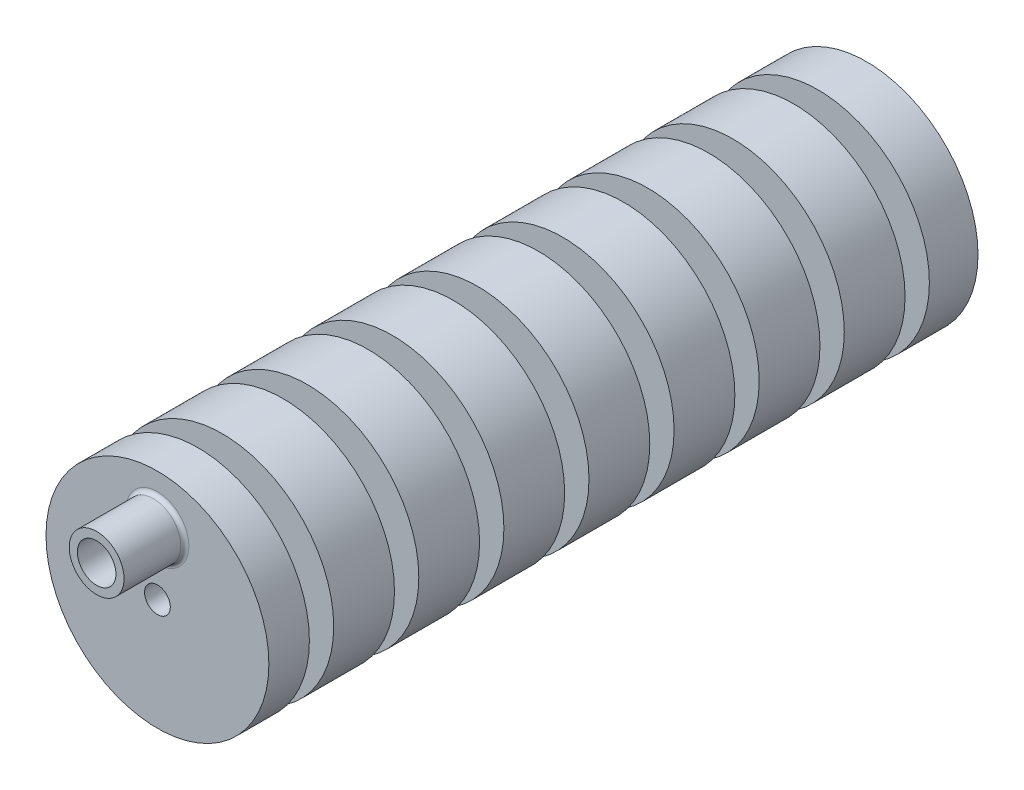
from build123d import *

# Parameters (mm, degrees)
SKETCH3_R             = 27.5
BOSS_EXTRUDE2_DEPTH   = 175
SKETCH5_R             = 3.175
CUT_EXTRUDE1_DEPTH    = 180.26935042
SKETCH4_W             = 16
SKETCH4_H             = 6
SHELL1_START          = 3
SHELL1_OUTLINE_R      = 8.5
SHELL1_OUTLINE_R_2    = 6.175
SHELL1_DEPTH          = 169
SHELL1_START_2        = 21
SHELL1_2_OUTLINE_R    = 24.5
SHELL1_2_OUTLINE_R_2  = 8.5
SHELL1_2_DEPTH        = 9
SHELL1_START_3        = 42
SHELL1_3_OUTLINE_R    = 24.5
SHELL1_3_OUTLINE_R_2  = 8.5
SHELL1_3_DEPTH        = 9
SHELL1_START_4        = 63
SHELL1_4_OUTLINE_R    = 24.5
SHELL1_4_OUTLINE_R_2  = 8.5
SHELL1_4_DEPTH        = 9
SHELL1_START_5        = 84
SHELL1_5_OUTLINE_R    = 24.5
SHELL1_5_OUTLINE_R_2  = 8.5
SHELL1_5_DEPTH        = 9
SHELL1_START_6        = 105
SHELL1_6_OUTLINE_R    = 24.5
SHELL1_6_OUTLINE_R_2  = 8.5
SHELL1_6_DEPTH        = 9
SHELL1_START_7        = 126
SHELL1_7_OUTLINE_R    = 24.5
SHELL1_7_OUTLINE_R_2  = 8.5
SHELL1_7_DEPTH        = 9
SHELL1_START_8        = 147
SHELL1_8_OUTLINE_R    = 24.5
SHELL1_8_OUTLINE_R_2  = 8.5
SHELL1_8_DEPTH        = 9
SHELL1_9_OUTLINE_R    = 24.5
SHELL1_9_OUTLINE_R_2  = 8.5
SHELL1_9_DEPTH        = 6
SHELL1_START_9        = 168
SHELL1_10_OUTLINE_R   = 24.5
SHELL1_10_OUTLINE_R_2 = 8.5
SHELL1_10_DEPTH       = 4
BOSS_EXTRUDE3_REACH   = 181.269
SKETCH11_W            = 6
SKETCH11_H            = 18.622661507
SKETCH11_H_2          = 18.562635142
SKETCH11_H_3          = 18.723636058
SKETCH11_H_4          = 19.102872432
SKETCH11_H_5          = 19.443952445
SKETCH11_H_6          = 20.46765219
SKETCH11_H_7          = 19.166783548
SKETCH11_H_8          = 20.128295153
SKETCH12_W            = 1.25
SKETCH12_H            = 4
SKETCH12_H_2          = 6
SKETCH12_H_3          = 9
SKETCH13_R            = 6.7625
SKETCH13_R_2          = 4.7625
BOSS_EXTRUDE4_DEPTH   = 15
CUT_EXTRUDE2_START    = -20
SKETCH14_R            = 4.7625
CUT_EXTRUDE2_DEPTH    = 20
FILLET1_R             = 1


# Read off the part's stored shape, not the designer's step: Shell1
with BuildPart() as part:
    # Sketch3 → Boss-Extrude2 (new body)
    with BuildSketch(Plane.XY):
        Circle(SKETCH3_R)
    extrude(amount=BOSS_EXTRUDE2_DEPTH)

    # Sketch5 → Cut-Extrude1 (cut, through all)
    with BuildSketch(Plane.XY.offset(175)):
        Circle(SKETCH5_R)
    extrude(amount=-CUT_EXTRUDE1_DEPTH, mode=Mode.SUBTRACT)

    # Sketch4 → Cut-Revolve1 (revolve, cut)
    with BuildSketch(Plane(origin=(0, 0, 0), x_dir=(1, 0, 0), z_dir=(0, 1, 0)), mode=Mode.PRIVATE) as cut_revolve1_sk:
        with Locations((-19.5, -162)):
            Rectangle(SKETCH4_W, SKETCH4_H)
        with Locations((-19.5, -141)):
            Rectangle(SKETCH4_W, SKETCH4_H)
        with Locations((-19.5, -120)):
            Rectangle(SKETCH4_W, SKETCH4_H)
        with Locations((-19.5, -99)):
            Rectangle(SKETCH4_W, SKETCH4_H)
        with Locations((-19.5, -78)):
            Rectangle(SKETCH4_W, SKETCH4_H)
        with Locations((-19.5, -57)):
            Rectangle(SKETCH4_W, SKETCH4_H)
        with Locations((-19.5, -36)):
            Rectangle(SKETCH4_W, SKETCH4_H)
        with Locations((-19.5, -15)):
            Rectangle(SKETCH4_W, SKETCH4_H)
    revolve(cut_revolve1_sk.sketch.rotate(Axis((0, 0, 175), (0, 0, -1)), 180), axis=Axis((0, 0, 175), (0, 0, -1)), mode=Mode.SUBTRACT)

    # Shell1 outline → Shell1 (cut)
    with BuildSketch(Plane.XY.offset(SHELL1_START)):
        Circle(SHELL1_OUTLINE_R)
        Circle(SHELL1_OUTLINE_R_2, mode=Mode.SUBTRACT)
    extrude(amount=SHELL1_DEPTH, mode=Mode.SUBTRACT)

    # Shell1 2 outline → Shell1 2 (cut)
    with BuildSketch(Plane.XY.offset(SHELL1_START_2)):
        Circle(SHELL1_2_OUTLINE_R)
        Circle(SHELL1_2_OUTLINE_R_2, mode=Mode.SUBTRACT)
    extrude(amount=SHELL1_2_DEPTH, mode=Mode.SUBTRACT)

    # Shell1 3 outline → Shell1 3 (cut)
    with BuildSketch(Plane.XY.offset(SHELL1_START_3)):
        Circle(SHELL1_3_OUTLINE_R)
        Circle(SHELL1_3_OUTLINE_R_2, mode=Mode.SUBTRACT)
    extrude(amount=SHELL1_3_DEPTH, mode=Mode.SUBTRACT)

    # Shell1 4 outline → Shell1 4 (cut)
    with BuildSketch(Plane.XY.offset(SHELL1_START_4)):
        Circle(SHELL1_4_OUTLINE_R)
        Circle(SHELL1_4_OUTLINE_R_2, mode=Mode.SUBTRACT)
    extrude(amount=SHELL1_4_DEPTH, mode=Mode.SUBTRACT)

    # Shell1 5 outline → Shell1 5 (cut)
    with BuildSketch(Plane.XY.offset(SHELL1_START_5)):
        Circle(SHELL1_5_OUTLINE_R)
        Circle(SHELL1_5_OUTLINE_R_2, mode=Mode.SUBTRACT)
    extrude(amount=SHELL1_5_DEPTH, mode=Mode.SUBTRACT)

    # Shell1 6 outline → Shell1 6 (cut)
    with BuildSketch(Plane.XY.offset(SHELL1_START_6)):
        Circle(SHELL1_6_OUTLINE_R)
        Circle(SHELL1_6_OUTLINE_R_2, mode=Mode.SUBTRACT)
    extrude(amount=SHELL1_6_DEPTH, mode=Mode.SUBTRACT)

    # Shell1 7 outline → Shell1 7 (cut)
    with BuildSketch(Plane.XY.offset(SHELL1_START_7)):
        Circle(SHELL1_7_OUTLINE_R)
        Circle(SHELL1_7_OUTLINE_R_2, mode=Mode.SUBTRACT)
    extrude(amount=SHELL1_7_DEPTH, mode=Mode.SUBTRACT)

    # Shell1 8 outline → Shell1 8 (cut)
    with BuildSketch(Plane.XY.offset(SHELL1_START_8)):
        Circle(SHELL1_8_OUTLINE_R)
        Circle(SHELL1_8_OUTLINE_R_2, mode=Mode.SUBTRACT)
    extrude(amount=SHELL1_8_DEPTH, mode=Mode.SUBTRACT)

    # Shell1 9 outline → Shell1 9 (cut)
    with BuildSketch(Plane.XY.offset(SHELL1_START)):
        Circle(SHELL1_9_OUTLINE_R)
        Circle(SHELL1_9_OUTLINE_R_2, mode=Mode.SUBTRACT)
    extrude(amount=SHELL1_9_DEPTH, mode=Mode.SUBTRACT)

    # Shell1 10 outline → Shell1 10 (cut)
    with BuildSketch(Plane.XY.offset(SHELL1_START_9)):
        Circle(SHELL1_10_OUTLINE_R)
        Circle(SHELL1_10_OUTLINE_R_2, mode=Mode.SUBTRACT)
    extrude(amount=SHELL1_10_DEPTH, mode=Mode.SUBTRACT)

    # Boss-Extrude3: up to this face of the body (flat: up to its plane)
    boss_extrude3_end = Plane(part.part.faces().sort_by_distance((-26.722182541, 0, 175))[0])
    # Sketch10 → Boss-Extrude3 (add, up to the picked face)
    with BuildSketch(Plane(origin=(0, 0, 0), x_dir=(-1, 0, 0), z_dir=(0, 0, -1)), mode=Mode.PRIVATE) as boss_extrude3_sk1:
        with BuildLine():
            Line((-1, 27.481812167), (-1, 3.01340754))
            ThreePointArc((-1, 3.01340754), (0, 3.175), (1, 3.01340754))
            Line((1, 3.01340754), (1, 27.481812167))
            ThreePointArc((1, 27.481812167), (0, 27.5), (-1, 27.481812167))
        make_face()
    boss_extrude3_tool1 = split(extrude(boss_extrude3_sk1.sketch, amount=-BOSS_EXTRUDE3_REACH, mode=Mode.PRIVATE), bisect_by=boss_extrude3_end, keep=Keep.BOTH, mode=Mode.PRIVATE)
    # Sketch10 → Boss-Extrude3 (add, up to the picked face)
    with BuildSketch(Plane(origin=(0, 0, 0), x_dir=(-1, 0, 0), z_dir=(0, 0, -1)), mode=Mode.PRIVATE) as boss_extrude3_sk2:
        with BuildLine():
            Line((3.01340754, 1), (27.481812167, 1))
            ThreePointArc((27.481812167, 1), (27.5, 0), (27.481812167, -1))
            Line((27.481812167, -1), (3.01340754, -1))
            ThreePointArc((3.01340754, -1), (3.175, 0), (3.01340754, 1))
        make_face()
    boss_extrude3_tool2 = split(extrude(boss_extrude3_sk2.sketch, amount=-BOSS_EXTRUDE3_REACH, mode=Mode.PRIVATE), bisect_by=boss_extrude3_end, keep=Keep.BOTH, mode=Mode.PRIVATE)
    # Sketch10 → Boss-Extrude3 (add, up to the picked face)
    with BuildSketch(Plane(origin=(0, 0, 0), x_dir=(-1, 0, 0), z_dir=(0, 0, -1)), mode=Mode.PRIVATE) as boss_extrude3_sk3:
        with BuildLine():
            Line((-1, -3.01340754), (-1, -27.481812167))
            ThreePointArc((-1, -27.481812167), (0, -27.5), (1, -27.481812167))
            Line((1, -27.481812167), (1, -3.01340754))
            ThreePointArc((1, -3.01340754), (0, -3.175), (-1, -3.01340754))
        make_face()
    boss_extrude3_tool3 = split(extrude(boss_extrude3_sk3.sketch, amount=-BOSS_EXTRUDE3_REACH, mode=Mode.PRIVATE), bisect_by=boss_extrude3_end, keep=Keep.BOTH, mode=Mode.PRIVATE)
    # Sketch10 → Boss-Extrude3 (add, up to the picked face)
    with BuildSketch(Plane(origin=(0, 0, 0), x_dir=(-1, 0, 0), z_dir=(0, 0, -1)), mode=Mode.PRIVATE) as boss_extrude3_sk4:
        with BuildLine():
            Line((-27.481812167, -1), (-3.01340754, -1))
            ThreePointArc((-3.01340754, -1), (-3.175, 0), (-3.01340754, 1))
            Line((-3.01340754, 1), (-27.481812167, 1))
            ThreePointArc((-27.481812167, 1), (-27.5, 0), (-27.481812167, -1))
        make_face()
    boss_extrude3_tool4 = split(extrude(boss_extrude3_sk4.sketch, amount=-BOSS_EXTRUDE3_REACH, mode=Mode.PRIVATE), bisect_by=boss_extrude3_end, keep=Keep.BOTH, mode=Mode.PRIVATE)
    add(boss_extrude3_tool1.solids().sort_by(Axis((0, 15.307771, 0), (0, 0, 1)))[0])
    add(boss_extrude3_tool2.solids().sort_by(Axis((-15.307771, 0, 0), (0, 0, 1)))[0])
    add(boss_extrude3_tool3.solids().sort_by(Axis((0, -15.307771, 0), (0, 0, 1)))[0])
    add(boss_extrude3_tool4.solids().sort_by(Axis((15.307771, 0, 0), (0, 0, 1)))[0])

    # Sketch11 → Cut-Revolve2 (revolve, cut)
    with BuildSketch(Plane(origin=(0, 0, 0), x_dir=(0, 0, -1), z_dir=(1, 0, 0)), mode=Mode.PRIVATE) as cut_revolve2_sk:
        with Locations((-162, 20.76776999)):
            Rectangle(SKETCH11_W, SKETCH11_H)
        with Locations((-141, 20.737756808)):
            Rectangle(SKETCH11_W, SKETCH11_H_2)
        with Locations((-120, 20.837335447)):
            Rectangle(SKETCH11_W, SKETCH11_H_3)
        with Locations((-99, 21.007875453)):
            Rectangle(SKETCH11_W, SKETCH11_H_4)
        with Locations((-78, 21.197493641)):
            Rectangle(SKETCH11_W, SKETCH11_H_5)
        with Locations((-57, 21.690265332)):
            Rectangle(SKETCH11_W, SKETCH11_H_6)
        with Locations((-36, 21.039831011)):
            Rectangle(SKETCH11_W, SKETCH11_H_7)
        with Locations((-15, 21.520586814)):
            Rectangle(SKETCH11_W, SKETCH11_H_8)
    revolve(cut_revolve2_sk.sketch.rotate(Axis((0, 0, 174.128746248), (0, 0, -1)), 90), axis=Axis((0, 0, 174.128746248), (0, 0, -1)), mode=Mode.SUBTRACT)

    # Sketch12 → Revolve1 (revolve)
    with BuildSketch(Plane(origin=(0, 0, 0), x_dir=(1, 0, 0), z_dir=(0, 1, 0))):
        with Locations((24.10458333, -170)):
            Rectangle(SKETCH12_W, SKETCH12_H)
        with Locations((24.10458333, -6)):
            Rectangle(SKETCH12_W, SKETCH12_H_2)
        with Locations((24.10458333, -151.5)):
            Rectangle(SKETCH12_W, SKETCH12_H_3)
        with Locations((24.10458333, -130.5)):
            Rectangle(SKETCH12_W, SKETCH12_H_3)
        with Locations((24.10458333, -109.5)):
            Rectangle(SKETCH12_W, SKETCH12_H_3)
        with Locations((24.10458333, -88.5)):
            Rectangle(SKETCH12_W, SKETCH12_H_3)
        with Locations((24.10458333, -67.5)):
            Rectangle(SKETCH12_W, SKETCH12_H_3)
        with Locations((24.10458333, -46.5)):
            Rectangle(SKETCH12_W, SKETCH12_H_3)
        with Locations((24.10458333, -25.5)):
            Rectangle(SKETCH12_W, SKETCH12_H_3)
    revolve(axis=Axis((0, 0, 0), (0, 0, 1)))

    # Sketch13 → Boss-Extrude4 (add)
    with BuildSketch(Plane.XY.offset(175)):
        with Locations((0, 15.3375)):
            Circle(SKETCH13_R)
        with Locations((0, 15.3375)):
            Circle(SKETCH13_R_2, mode=Mode.SUBTRACT)
    extrude(amount=BOSS_EXTRUDE4_DEPTH)

    # Sketch14 → Cut-Extrude2 (cut)
    with BuildSketch(Plane.XY.offset(190).offset(CUT_EXTRUDE2_START)):
        with Locations(Location((0, 15.3375, 0), (0, 0, 102.120814125))):
            Circle(SKETCH14_R)
    extrude(amount=CUT_EXTRUDE2_DEPTH, mode=Mode.SUBTRACT)

    # Fillet1
    fillet1_edges = [part.edges().sort_by_distance(p)[0] for p in [
        (5.12317803, 19.751619745, 175),
    ]]
    fillet(fillet1_edges, radius=FILLET1_R)


solid = part.part
